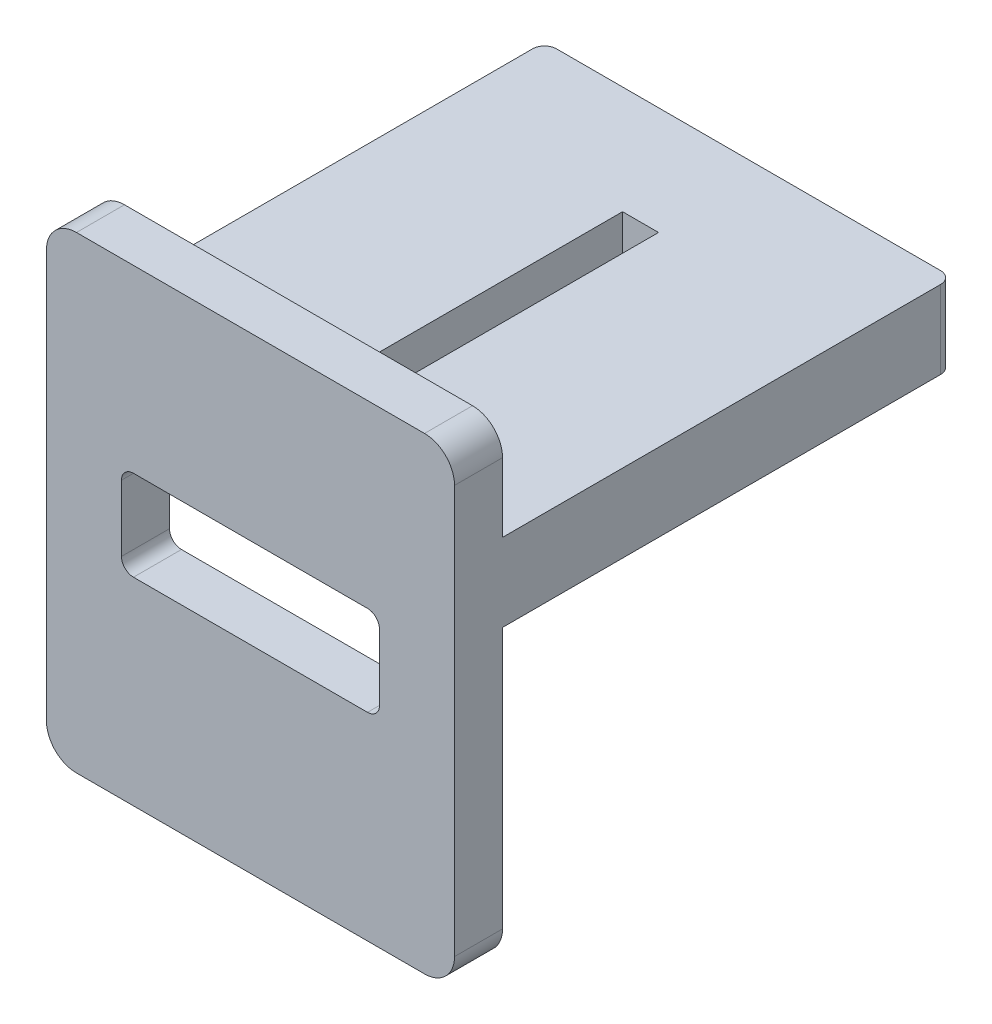
from build123d import *

# Parameters (mm, degrees)
SKETCH1_W           = 68
SKETCH1_H           = 78
BOSS_EXTRUDE1_DEPTH = 8
BOSS_EXTRUDE2_DEPTH = 75
CUT_EXTRUDE1_REACH  = 99.806
SKETCH3_W           = 43
SKETCH3_H           = 15
FILLET1_R           = 2
FILLET2_R           = 5
SKETCH4_W           = 6
SKETCH4_H           = 45
CUT_EXTRUDE2_DEPTH  = 103.777672673


with BuildPart() as part:
    # Sketch1 → Boss-Extrude1 (new body)
    with BuildSketch(Plane.XY):
        Rectangle(SKETCH1_W, SKETCH1_H)
    extrude(amount=BOSS_EXTRUDE1_DEPTH)

    # Sketch2 → Boss-Extrude2 (add)
    with BuildSketch(Plane(origin=(0, 0, 0), x_dir=(-1, 0, 0), z_dir=(0, 0, -1))):
        Polygon((-34, 22.5), (34, 22.5), (34, 9.5), (19.5, 9.5), (19.5, 15.5), (-19.5, 15.5), (-19.5, 9.5), (-34, 9.5), align=None)
    extrude(amount=BOSS_EXTRUDE2_DEPTH)

    # Sketch3 → Cut-Extrude1 (cut, up to next)
    with BuildSketch(Plane.XY.offset(8), mode=Mode.PRIVATE) as cut_extrude1_sk1:
        with Locations((0, 1.5)):
            Rectangle(SKETCH3_W, SKETCH3_H)
    cut_extrude1_tool1 = extrude(cut_extrude1_sk1.sketch, amount=-CUT_EXTRUDE1_REACH, mode=Mode.PRIVATE) & part.part
    add(cut_extrude1_tool1.solids().sort_by_distance((0, 1.5, 8))[0], mode=Mode.SUBTRACT)

    # Fillet1
    fillet1_edges = [part.edges().sort_by_distance(p)[0] for p in [
        (-21.5, -6, 4),
        (21.5, -6, 4),
        (21.5, 9, 4),
        (-21.5, 9, 4),
        (-34, 16, -75),
        (34, 16, -75),
    ]]
    fillet(fillet1_edges, radius=FILLET1_R)

    # Fillet2
    fillet2_edges = [part.edges().sort_by_distance(p)[0] for p in [
        (34, 39, 4),
        (34, -39, 4),
        (-34, -39, 4),
        (-34, 39, 4),
    ]]
    fillet(fillet2_edges, radius=FILLET2_R)

    # Sketch4 → Cut-Extrude2 (cut, through all)
    with BuildSketch(Plane(origin=(0, 22.5, 0), x_dir=(1, 0, 0), z_dir=(0, 1, 0))):
        with Locations((0, 34.5)):
            Rectangle(SKETCH4_W, SKETCH4_H)
    extrude(amount=-CUT_EXTRUDE2_DEPTH, mode=Mode.SUBTRACT)


solid = part.part
